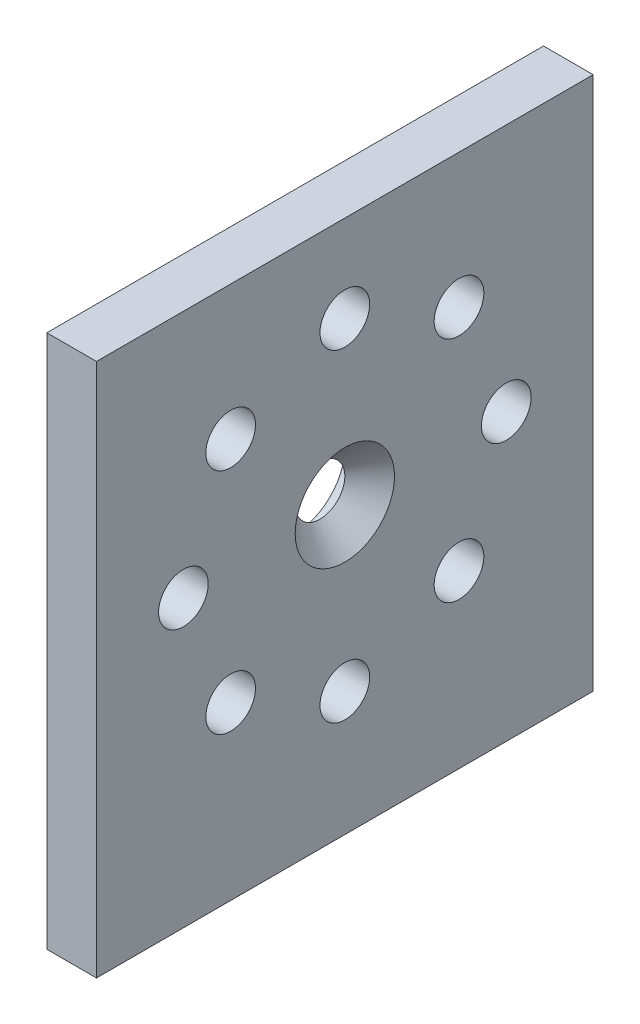
from build123d import *

# Parameters (mm, degrees)
ESQUISSE1_W      = 4
ESQUISSE1_H      = 43
EXTRUSION1_DEPTH = 40
ESQUISSE2_R      = 2
EXTRUSION2_DEPTH = 59.864250611
ESQUISSE3_R      = 4
EXTRUSION3_DEPTH = 2
CHANFREIN1_SIZE  = 2


with BuildPart() as part:
    # Esquisse1 → Extrusion1 (new body)
    with BuildSketch(Plane.XY):
        with Locations((2, 21.5)):
            Rectangle(ESQUISSE1_W, ESQUISSE1_H)
    extrude(amount=EXTRUSION1_DEPTH)

    # Esquisse2 → Extrusion2 (cut, through all)
    with BuildSketch(Plane.ZY):
        with Locations((29.192388155, 32.192388155)):
            Circle(ESQUISSE2_R)
        with Locations((20, 23)):
            Circle(ESQUISSE2_R)
        with Locations((20, 36)):
            Circle(ESQUISSE2_R)
        with Locations((33, 23)):
            Circle(ESQUISSE2_R)
        with Locations((29.192388155, 13.807611845)):
            Circle(ESQUISSE2_R)
        with Locations((20, 10)):
            Circle(ESQUISSE2_R)
        with Locations((10.807611845, 13.807611845)):
            Circle(ESQUISSE2_R)
        with Locations((7, 23)):
            Circle(ESQUISSE2_R)
        with Locations((10.807611845, 32.192388155)):
            Circle(ESQUISSE2_R)
    extrude(amount=-EXTRUSION2_DEPTH, mode=Mode.SUBTRACT)

    # Esquisse3 → Extrusion3 (cut)
    with BuildSketch(Plane.ZY):
        with Locations((20, 23)):
            Circle(ESQUISSE3_R)
    extrude(amount=-EXTRUSION3_DEPTH, mode=Mode.SUBTRACT)

    # Chanfrein1
    chanfrein1_edges = [part.edges().sort_by_distance(p)[0] for p in [
        (4, 23, 18),
    ]]
    chamfer(chanfrein1_edges, length=CHANFREIN1_SIZE - 0.0001)  # a hair under: the kernel refuses the full size


solid = part.part
